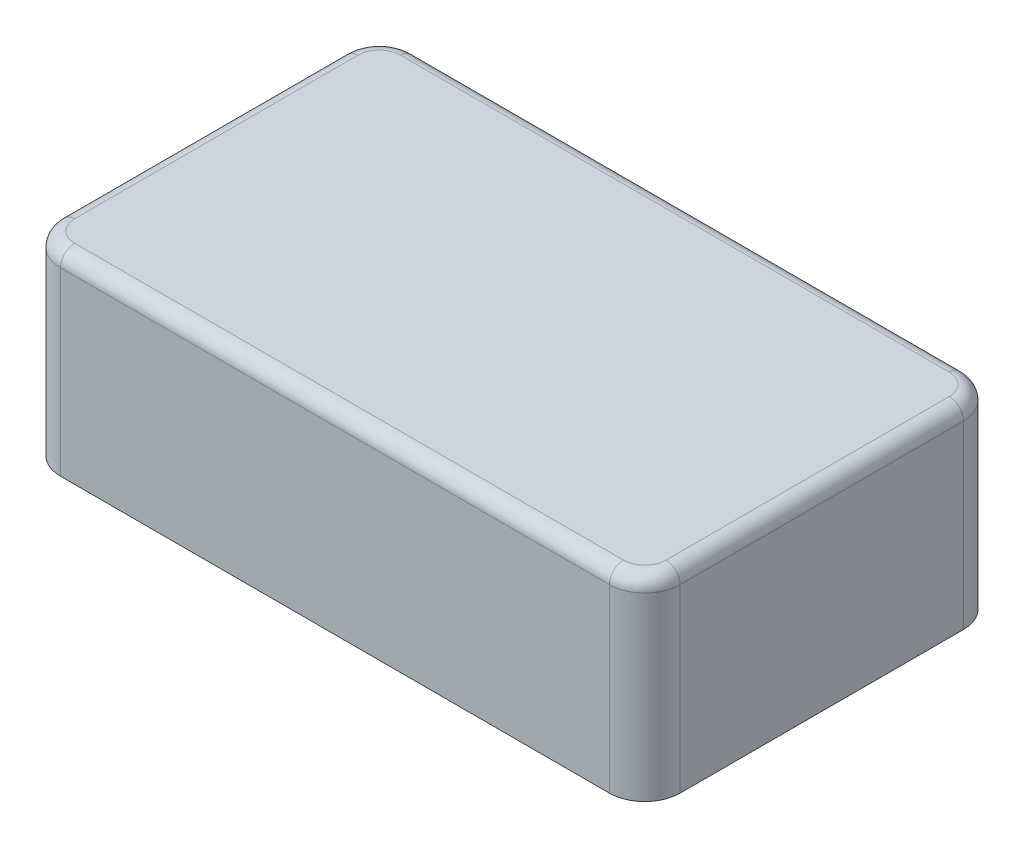
from build123d import *

# Parameters (mm, degrees)
BOSS_EXTRU_1_DEPTH = 1.1
CONG_1_R           = 0.08


with BuildPart() as part:
    # Esquisse1 → Boss.-Extru.1 (new body)
    with BuildSketch(Plane(origin=(0, 0, 0), x_dir=(1, 0, 0), z_dir=(0, 1, 0))):
        with BuildLine():
            Line((1.55, -1), (-1.55, -1))
            ThreePointArc((-1.55, -1), (-1.691421356, -0.941421356), (-1.75, -0.8))
            Line((-1.75, -0.8), (-1.75, 0.8))
            ThreePointArc((-1.75, 0.8), (-1.691421356, 0.941421356), (-1.55, 1))
            Line((-1.55, 1), (1.55, 1))
            ThreePointArc((1.55, 1), (1.691421356, 0.941421356), (1.75, 0.8))
            Line((1.75, 0.8), (1.75, -0.8))
            ThreePointArc((1.75, -0.8), (1.691421356, -0.941421356), (1.55, -1))
        make_face()
    extrude(amount=BOSS_EXTRU_1_DEPTH)

    # Congé1
    cong_1_edges = [part.edges().sort_by_distance(p)[0] for p in [
        (1.75, 1.1, 0),
        (1.691421356, 1.1, 0.941421356),
        (0, 1.1, 1),
        (-1.691421356, 1.1, 0.941421356),
        (-1.75, 1.1, 0),
        (-1.691421356, 1.1, -0.941421356),
        (0, 1.1, -1),
        (1.691421356, 1.1, -0.941421356),
    ]]
    fillet(cong_1_edges, radius=CONG_1_R)


solid = part.part
